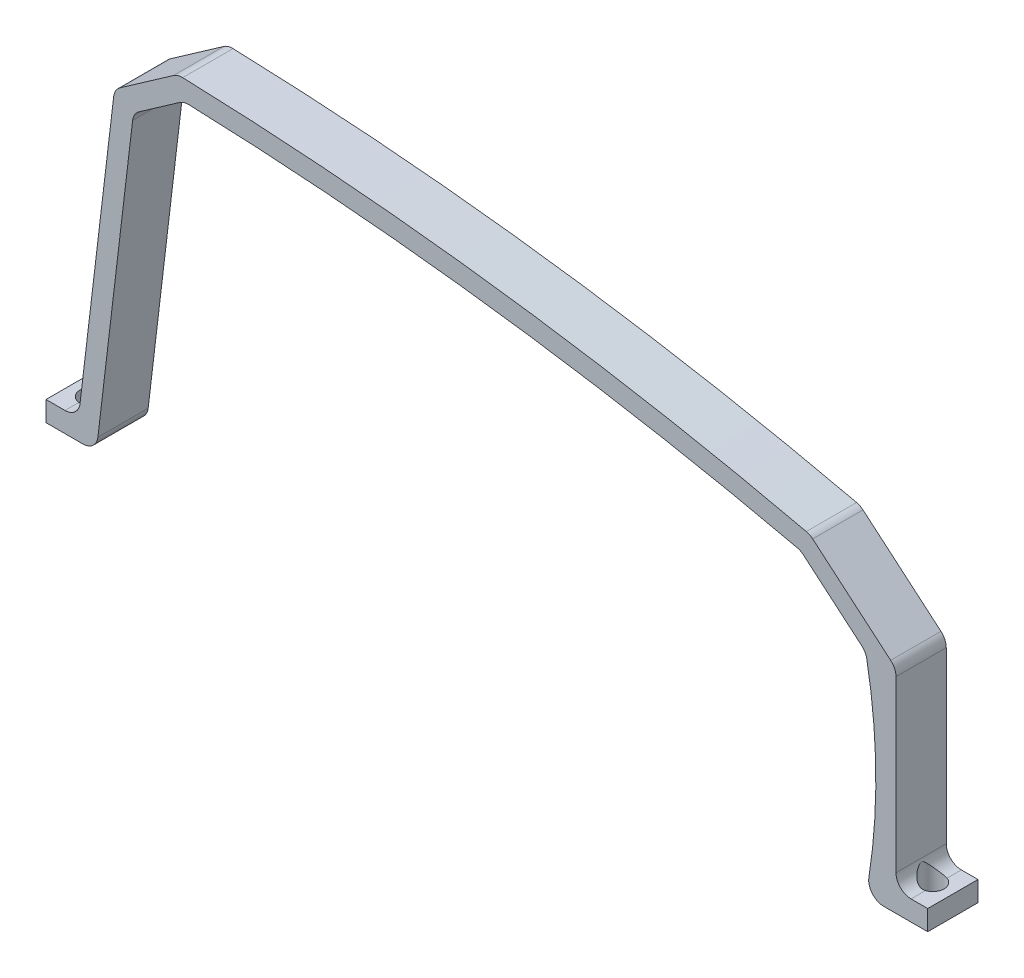
from build123d import *

# Parameters (mm, degrees)
BOSS_EXTRU_1_DEPTH           = 10
ESQUISSE2_W                  = 10
ESQUISSE2_H                  = 4
BOSS_EXTRU_2_DEPTH           = 10
ENL_V_MAT_EXTRU_1_DEPTH      = 180.426169252
ENL_V_MAT_EXTRU_1_DEPTH_BACK = 180.426169252
ESQUISSE3_R                  = 2.25
CONG_1_START                 = -1
CONG_1_DEPTH                 = 12
CONG_1_START_2               = 7.2500001
CONG_1_2_DEPTH               = 2.7499999
CONG_1_3_DEPTH               = 2.749998557
CONG_1_START_3               = 1.0274
CONG_1_4_DEPTH               = 7.9164
CONG_1_START_4               = 2.749998557
CONG_1_5_DEPTH               = 4.500001543
CONG_1_START_5               = 4
CONG_1_6_OUTLINE_R           = 2.25
CONG_1_6_DEPTH               = 2.645361331


with BuildPart() as part:
    # Esquisse1 → Boss.-Extru.1 (new body)
    with BuildSketch(Plane.XY):
        with BuildLine():
            Line((0, 0), (7.380952381, 62))
            Line((7.380952381, 62), (17.380952381, 69))
            ThreePointArc((17.380952381, 69), (79.097781351, 63.974797541), (140.038518603, 53))
            Line((140.038518603, 53), (153, 42))
            ThreePointArc((153, 42), (155, 21), (153, 0))
            Line((153, 0), (159, 0))
            Line((159, 0), (159, 42.15430335))
            Line((159, 42.15430335), (156.65156229, 44.147348282))
            Line((156.65156229, 44.147348282), (141.886380642, 56.678091733))
            ThreePointArc((141.886380642, 56.678091733), (79.436142512, 67.964522606), (16.177522156, 73.040221089))
            Line((16.177522156, 73.040221089), (3.620610131, 64.250382671))
            Line((3.620610131, 64.250382671), (-3.971953097, 0.472851559))
            Line((-3.971953097, 0.472851559), (-3.971953097, 0))
            Line((-3.971953097, 0), (0, 0))
        make_face()
    extrude(amount=BOSS_EXTRU_1_DEPTH)

    # Esquisse2 → Boss.-Extru.2 (add)
    with BuildSketch(Plane.XY.offset(10)):
        with Locations((-5, 2)):
            Rectangle(ESQUISSE2_W, ESQUISSE2_H)
        Polygon((155.309401077, 4), (153, 0), (165.309401077, 0), (165.309401077, 4), align=None)
    extrude(amount=-BOSS_EXTRU_2_DEPTH)

    # Esquisse3 → Enlèv. mat.-Extru.1 (cut, two sides: drawn at the far end of the back side and taken through both)
    with BuildSketch(Plane(origin=(0, 4, 0), x_dir=(1, 0, 0), z_dir=(0, 1, 0)).offset(-ENL_V_MAT_EXTRU_1_DEPTH_BACK)):
        with Locations(Location((-6, -5, 0), (0, 0, 180))):
            Circle(ESQUISSE3_R)
        with Locations(Location((161.309401077, -5, 0), (0, 0, 180))):
            Circle(ESQUISSE3_R)
    extrude(amount=ENL_V_MAT_EXTRU_1_DEPTH + ENL_V_MAT_EXTRU_1_DEPTH_BACK, mode=Mode.SUBTRACT)

    # Congé1: read off the stored shape, not the designer's step
    # Congé1 outline → Congé1 (cut)
    with BuildSketch(Plane.XY.offset(CONG_1_START)):
        with BuildLine():
            Line((16.177522156, 73.040221089), (15.360062357, 72.46799923))
            ThreePointArc((15.360062357, 72.46799923), (16.22479158, 72.885690349), (17.177199346, 73.00874297))
            ThreePointArc((17.177199346, 73.00874297), (16.677366871, 73.02467639), (16.177522156, 73.040221089))
        make_face()
        with BuildLine():
            ThreePointArc((3.461901996, 62.917234337), (3.866631155, 64.103151006), (4.720479785, 65.020291429))
            Line((4.720479785, 65.020291429), (3.620610131, 64.250382671))
            Line((3.620610131, 64.250382671), (3.461901996, 62.917234337))
        make_face()
        with BuildLine():
            Line((159, 42.15430335), (157.941176471, 43.052893447))
            ThreePointArc((157.941176471, 43.052893447), (158.722455639, 42.025825276), (159, 40.7655732))
            Line((159, 40.7655732), (159, 42.15430335))
        make_face()
        with BuildLine():
            ThreePointArc((141.886380642, 56.678091733), (141.530964579, 56.760515154), (141.175501808, 56.842736905))
            ThreePointArc((141.175501808, 56.842736905), (141.846525936, 56.600679011), (142.441431075, 56.207037956))
            Line((142.441431075, 56.207037956), (141.886380642, 56.678091733))
        make_face()
        with BuildLine():
            Line((0, 0), (0.314923968, 2.645361331))
            ThreePointArc((0.314923968, 2.645361331), (-0.672046378, 0.756797378), (-2.664040855, 0))
            Line((-2.664040855, 0), (0, 0))
        make_face()
        with BuildLine():
            ThreePointArc((156.573147005, 0), (154.290829859, 1.052943646), (153.610613604, 3.472647702))
            ThreePointArc((153.610613604, 3.472647702), (153.319065292, 1.733904625), (153, 0))
            Line((153, 0), (156.573147005, 0))
        make_face()
    extrude(amount=CONG_1_DEPTH, mode=Mode.SUBTRACT)

    # Cong_1 2 outline → Cong_1 2 (add)
    with BuildSketch(Plane.XY.offset(CONG_1_START_2)):
        with BuildLine():
            Line((-3.552054473, 4), (-3.237130505, 6.645361331))
            ThreePointArc((-3.237130505, 6.645361331), (-4.224100851, 4.756797378), (-6.216095328, 4))
            Line((-6.216095328, 4), (-3.552054473, 4))
        make_face()
        with BuildLine():
            ThreePointArc((162, 4), (159.878679656, 4.878679656), (159, 7))
            Line((159, 7), (159, 4))
            Line((159, 4), (162, 4))
        make_face()
        with BuildLine():
            Line((153, 42), (152.188329288, 42.688839304))
            ThreePointArc((152.188329288, 42.688839304), (152.845168439, 41.901623997), (153.198575067, 40.939205498))
            ThreePointArc((153.198575067, 40.939205498), (153.100573868, 41.469843544), (153, 42))
        make_face()
        with BuildLine():
            ThreePointArc((7.222244246, 60.666851666), (7.626973405, 61.852768335), (8.480822035, 62.769908758))
            Line((8.480822035, 62.769908758), (7.380952381, 62))
            Line((7.380952381, 62), (7.222244246, 60.666851666))
        make_face()
        with BuildLine():
            ThreePointArc((16.560647408, 68.425786519), (17.428384152, 68.844370904), (18.384055662, 68.96632134))
            ThreePointArc((18.384055662, 68.96632134), (17.882510633, 68.983357604), (17.380952381, 69))
            Line((17.380952381, 69), (16.560647408, 68.425786519))
        make_face()
        with BuildLine():
            ThreePointArc((139.325020621, 53.164109281), (139.998459684, 52.922050789), (140.595410438, 52.527383484))
            Line((140.595410438, 52.527383484), (140.038518603, 53))
            ThreePointArc((140.038518603, 53), (139.681793114, 53.08215682), (139.325020621, 53.164109281))
        make_face()
    extrude(amount=CONG_1_2_DEPTH)

    # Cong_1 3 outline → Cong_1 3 (add)
    with BuildSketch(Plane.XY):
        with BuildLine():
            Line((-3.552054473, 4), (-3.237130505, 6.645361331))
            ThreePointArc((-3.237130505, 6.645361331), (-4.224100851, 4.756797378), (-6.216095328, 4))
            Line((-6.216095328, 4), (-3.552054473, 4))
        make_face()
        with BuildLine():
            ThreePointArc((162, 4), (159.878679656, 4.878679656), (159, 7))
            Line((159, 7), (159, 4))
            Line((159, 4), (162, 4))
        make_face()
        with BuildLine():
            Line((153, 42), (152.188329288, 42.688839304))
            ThreePointArc((152.188329288, 42.688839304), (152.845168439, 41.901623997), (153.198575067, 40.939205498))
            ThreePointArc((153.198575067, 40.939205498), (153.100573868, 41.469843544), (153, 42))
        make_face()
        with BuildLine():
            ThreePointArc((7.222244246, 60.666851666), (7.626973405, 61.852768335), (8.480822035, 62.769908758))
            Line((8.480822035, 62.769908758), (7.380952381, 62))
            Line((7.380952381, 62), (7.222244246, 60.666851666))
        make_face()
        with BuildLine():
            ThreePointArc((16.560647408, 68.425786519), (17.428384152, 68.844370904), (18.384055662, 68.96632134))
            ThreePointArc((18.384055662, 68.96632134), (17.882510633, 68.983357604), (17.380952381, 69))
            Line((17.380952381, 69), (16.560647408, 68.425786519))
        make_face()
        with BuildLine():
            ThreePointArc((139.325020621, 53.164109281), (139.998459684, 52.922050789), (140.595410438, 52.527383484))
            Line((140.595410438, 52.527383484), (140.038518603, 53))
            ThreePointArc((140.038518603, 53), (139.681793114, 53.08215682), (139.325020621, 53.164109281))
        make_face()
    extrude(amount=CONG_1_3_DEPTH)

    # Cong_1 4 outline → Cong_1 4 (add)
    with BuildSketch(Plane.XY.offset(CONG_1_START_3)):
        with BuildLine():
            Line((153, 42), (152.188329288, 42.688839304))
            ThreePointArc((152.188329288, 42.688839304), (152.845168439, 41.901623997), (153.198575067, 40.939205498))
            ThreePointArc((153.198575067, 40.939205498), (153.100573868, 41.469843544), (153, 42))
        make_face()
        with BuildLine():
            ThreePointArc((7.222244246, 60.666851666), (7.626973405, 61.852768335), (8.480822035, 62.769908758))
            Line((8.480822035, 62.769908758), (7.380952381, 62))
            Line((7.380952381, 62), (7.222244246, 60.666851666))
        make_face()
        with BuildLine():
            ThreePointArc((16.560647408, 68.425786519), (17.428384152, 68.844370904), (18.384055662, 68.96632134))
            ThreePointArc((18.384055662, 68.96632134), (17.882510633, 68.983357604), (17.380952381, 69))
            Line((17.380952381, 69), (16.560647408, 68.425786519))
        make_face()
        with BuildLine():
            ThreePointArc((139.325020621, 53.164109281), (139.998459684, 52.922050789), (140.595410438, 52.527383484))
            Line((140.595410438, 52.527383484), (140.038518603, 53))
            ThreePointArc((140.038518603, 53), (139.681793114, 53.08215682), (139.325020621, 53.164109281))
        make_face()
    extrude(amount=CONG_1_4_DEPTH)

    # Cong_1 5 outline → Cong_1 5 (add)
    with BuildSketch(Plane.XY.offset(CONG_1_START_4)):
        with BuildLine():
            Line((159, 4), (162, 4))
            ThreePointArc((162, 4), (159.878679656, 4.878679656), (159, 7))
            Line((159, 7), (159, 4))
        make_face()
        with BuildLine():
            ThreePointArc((-3.237130505, 6.645361331), (-4.224100851, 4.756797378), (-6.216095328, 4))
            Line((-6.216095328, 4), (-3.552054473, 4))
            Line((-3.552054473, 4), (-3.237130505, 6.645361331))
        make_face()
    extrude(amount=CONG_1_5_DEPTH)

    # Cong_1 6 outline → Cong_1 6 (cut)
    with BuildSketch(Plane(origin=(0, 0, 0), x_dir=(1, 0, 0), z_dir=(0, 1, 0)).offset(CONG_1_START_5)):
        with Locations((161.309401077, -5)):
            Circle(CONG_1_6_OUTLINE_R)
        with Locations((-6, -5)):
            Circle(CONG_1_6_OUTLINE_R)
    extrude(amount=CONG_1_6_DEPTH, mode=Mode.SUBTRACT)


solid = part.part
